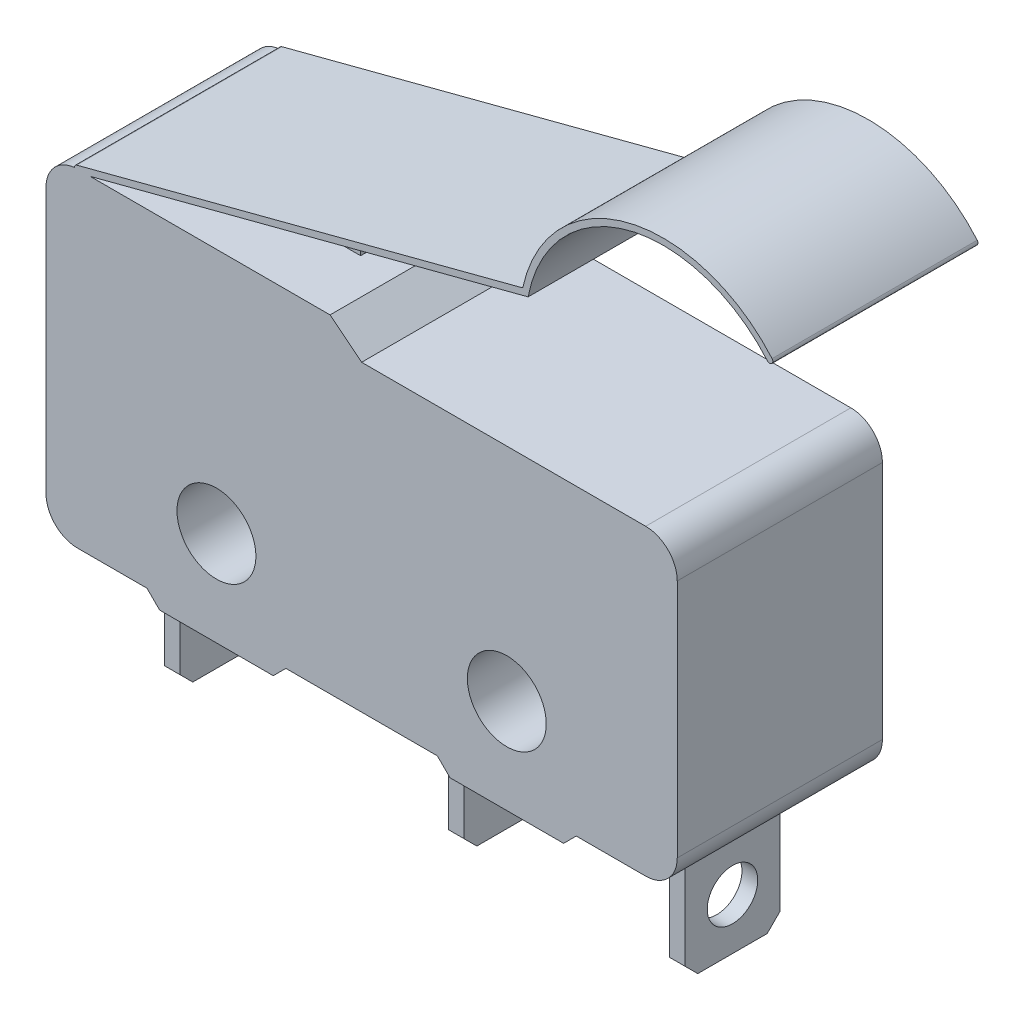
from build123d import *

# Parameters (mm, degrees)
SKETCH2_R                = 1.25
BOSS_EXTRUDE1_DEPTH      = 6.5
CHAMFER1_SIZE            = 0.4
SKETCH3_W                = 2
SKETCH3_H                = 2
BOSS_EXTRUDE2_DEPTH      = 1.5
FILLET1_R                = 1
BOSS_EXTRUDE3_DEPTH      = 4
CHAMFER2_SIZE            = 0.4
SKETCH5_R                = 0.8
CUT_EXTRUDE2_DEPTH       = 18
BOSS_EXTRUDE4_DEPTH      = 0.1
RESSALTO_EXTRUS_O1_REACH = 26.39


with BuildPart() as part:
    # Sketch2 → Boss-Extrude1 (new body)
    with BuildSketch(Plane.XY):
        with BuildLine():
            ThreePointArc((0, 9.8), (0.292893219, 10.507106781), (1, 10.8))
            Line((1, 10.8), (9, 10.8))
            Line((9, 10.8), (10, 10))
            Line((10, 10), (19, 10))
            ThreePointArc((19, 10), (19.707106781, 9.707106781), (20, 9))
            Line((20, 9), (20, 1.4))
            ThreePointArc((20, 1.4), (19.707106781, 0.692893219), (19, 0.4))
            Line((19, 0.4), (16.4, 0.4))
            Line((16.4, 0.4), (16.4, 0))
            Line((16.4, 0), (12.8, 0))
            Line((12.8, 0), (12.8, 0.4))
            Line((12.8, 0.4), (7.2, 0.4))
            Line((7.2, 0.4), (7.2, 0))
            Line((7.2, 0), (3.6, 0))
            Line((3.6, 0), (3.6, 0.4))
            Line((3.6, 0.4), (1, 0.4))
            ThreePointArc((1, 0.4), (0.292893219, 0.692893219), (0, 1.4))
            Line((0, 1.4), (0, 9.8))
        make_face()
        with Locations(Location((14.6, 3, 0), (0, 0, 180))):
            Circle(SKETCH2_R, mode=Mode.SUBTRACT)
        with Locations(Location((5.4, 3, 0), (0, 0, 180))):
            Circle(SKETCH2_R, mode=Mode.SUBTRACT)
    extrude(amount=BOSS_EXTRUDE1_DEPTH)

    # Chamfer1
    chamfer1_edges = [part.edges().sort_by_distance(p)[0] for p in [
        (3.6, 0.4, 3.25),
        (7.2, 0.4, 3.25),
        (12.8, 0.4, 3.25),
        (16.4, 0.4, 3.25),
    ]]
    chamfer(chamfer1_edges, length=CHAMFER1_SIZE - 0.0001)  # a hair under: the kernel refuses the full size

    # Sketch3 → Boss-Extrude2 (add)
    with BuildSketch(Plane(origin=(0, 10.8, 0), x_dir=(1, 0, 0), z_dir=(0, 1, 0))):
        with Locations((6.861600277, -3.393126413)):
            Rectangle(SKETCH3_W, SKETCH3_H)
    extrude(amount=BOSS_EXTRUDE2_DEPTH)

    # Fillet1
    fillet1_edges = [part.edges().sort_by_distance(p)[0] for p in [
        (5.861600277, 12.3, 3.393126413),
        (7.861600277, 12.3, 3.393126413),
    ]]
    fillet(fillet1_edges, radius=FILLET1_R - 0.0001)  # a hair under: the kernel refuses the full size

    # Sketch4 → Boss-Extrude3 (add)
    with BuildSketch(Plane.XZ.offset(-0.4)):
        Polygon((2, 3.25), (2, 4.75), (2.5, 4.75), (2.5, 1.75), (2.037861295, 1.75), align=None)
        Polygon((11, 3.25), (11, 4.75), (11.5, 4.75), (11.5, 1.75), (11, 1.75), align=None)
        Polygon((18, 3.25), (18, 4.75), (18.5, 4.75), (18.5, 1.75), (18, 1.75), align=None)
    extrude(amount=BOSS_EXTRUDE3_DEPTH)

    # Chamfer2
    chamfer2_edges = [part.edges().sort_by_distance(p)[0] for p in [
        (2.268930648, -3.6, 1.75),
        (2.25, -3.6, 4.75),
        (11.25, -3.6, 1.75),
        (11.25, -3.6, 4.75),
        (18.25, -3.6, 1.75),
        (18.25, -3.6, 4.75),
    ]]
    chamfer(chamfer2_edges, length=CHAMFER2_SIZE)

    # Sketch5 → Cut-Extrude2 (cut)
    with BuildSketch(Plane(origin=(18.5, 0, 0), x_dir=(0, 0, -1), z_dir=(1, 0, 0))):
        with Locations(Location((-3.25, -1.983091363, 0), (0, 0, 90))):
            Circle(SKETCH5_R)
    extrude(amount=-CUT_EXTRUDE2_DEPTH, mode=Mode.SUBTRACT)

    # Sketch6 → Boss-Extrude4 (add)
    # profile 1 of 8: a face of its own
    with BuildSketch(Plane(origin=(0, 0, 0), x_dir=(-1, 0, 0), z_dir=(0, 0, -1))):
        with BuildLine():
            Line((-15.857970631, 8.152098297), (-15.857970631, 7.93500428))
            Line((-15.857970631, 7.93500428), (-16.577942586, 7.93500428))
            Line((-16.577942586, 7.93500428), (-16.692001747, 7.37827685))
            add(Edge.make_bspline(
                [(-16.692001747, 7.37827685), (-16.669591766, 7.384463728), (-16.626175972, 7.396449827), (-16.562095485, 7.409758079), (-16.501261152, 7.417780514), (-16.461785095, 7.418875926), (-16.442682837, 7.41940599)],
                knots=[0, 0, 0, 0, 1.100273476, 2.13160584, 3.095893838, 4, 4, 4, 4], degree=3))
            add(Edge.make_bspline(
                [(-16.442682837, 7.41940599), (-16.41904648, 7.4188944), (-16.372571497, 7.417888487), (-16.304572705, 7.408229321), (-16.23966186, 7.393025658), (-16.177974713, 7.371786105), (-16.119397141, 7.344626409), (-16.064468092, 7.310699302), (-16.012363069, 7.27106724), (-15.964016833, 7.225501447), (-15.920156895, 7.175353612), (-15.881593653, 7.121434328), (-15.848838182, 7.064267599), (-15.822494297, 7.003307231), (-15.801458057, 6.939227171), (-15.787456612, 6.871353181), (-15.778133174, 6.800325032), (-15.77709154, 6.751759888), (-15.776560374, 6.726994799)],
                knots=[0, 0, 0, 0, 1.052922333, 2.070308379, 3.05430497, 4.020497103, 4.973039431, 5.925935799, 6.892292201, 7.88610001, 8.88166317, 9.857072816, 10.836096531, 11.812156883, 12.81219415, 13.836441305, 14.89672472, 16, 16, 16, 16], degree=3))
            add(Edge.make_bspline(
                [(-15.776560374, 6.726994799), (-15.776962587, 6.709745646), (-15.777761575, 6.675480449), (-15.781824721, 6.624593242), (-15.78964775, 6.574783338), (-15.800151087, 6.52604413), (-15.813783883, 6.47846789), (-15.830287263, 6.431918442), (-15.850483908, 6.386685514), (-15.872637169, 6.342341108), (-15.897581467, 6.299887725), (-15.925266565, 6.260185719), (-15.954516171, 6.222639511), (-15.985988819, 6.187651777), (-16.01997704, 6.155452428), (-16.05606921, 6.125850372), (-16.093977331, 6.098344996), (-16.134287882, 6.074052802), (-16.176102622, 6.051699014), (-16.2200254, 6.033360494), (-16.265056396, 6.016965079), (-16.311843725, 6.00389646), (-16.360281412, 5.993656296), (-16.4104493, 5.986701171), (-16.462084276, 5.981635421), (-16.497084879, 5.98131831), (-16.514764835, 5.981158127)],
                knots=[0, 0, 0, 0, 1.056347294, 2.098418968, 3.122841568, 4.141288669, 5.149314143, 6.15115421, 7.162517403, 8.180376062, 9.185164535, 10.17417709, 11.141909838, 12.097768115, 13.052685741, 14.0056014, 14.954263652, 15.917497458, 16.885230207, 17.854509472, 18.828990115, 19.81800267, 20.826176721, 21.857883937, 22.917946725, 24, 24, 24, 24], degree=3))
            add(Edge.make_bspline(
                [(-16.514764835, 5.981158127), (-16.535855411, 5.981575919), (-16.577348627, 5.982397876), (-16.638139637, 5.990996675), (-16.696628946, 6.003311995), (-16.752345722, 6.021839644), (-16.805789295, 6.045054818), (-16.856240177, 6.07439555), (-16.90498748, 6.107644818), (-16.950049521, 6.146881983), (-16.991872504, 6.189769086), (-17.029311202, 6.236310136), (-17.062653889, 6.285736989), (-17.091366622, 6.338289682), (-17.115858282, 6.393830127), (-17.135098775, 6.452566418), (-17.150628066, 6.514191659), (-17.157197849, 6.556617829), (-17.160534733, 6.578166674)],
                knots=[0, 0, 0, 0, 1.0467383, 2.05933395, 3.04377827, 4.011590433, 4.970194871, 5.932262533, 6.905835911, 7.896367577, 8.894135286, 9.877477877, 10.858688626, 11.851381753, 12.8477658, 13.868841284, 14.917554742, 16, 16, 16, 16], degree=3))
            Line((-17.160534733, 6.578166674), (-16.970577468, 6.578166674))
            add(Edge.make_bspline(
                [(-16.970577468, 6.578166674), (-16.965903531, 6.557981867), (-16.956919965, 6.519185547), (-16.93720125, 6.464677545), (-16.913091887, 6.416103538), (-16.884423543, 6.372820981), (-16.850224239, 6.335078397), (-16.811199299, 6.301443317), (-16.767446152, 6.27109931), (-16.718827389, 6.245806493), (-16.66753567, 6.22423539), (-16.613852643, 6.20987127), (-16.559240014, 6.199771206), (-16.522302143, 6.198760189), (-16.503740529, 6.198252144)],
                knots=[0, 0, 0, 0, 1.136247022, 2.183929868, 3.172523383, 4.106158343, 5.02341133, 5.958108904, 6.928429099, 7.938127109, 8.96079061, 9.975095812, 10.982467395, 12, 12, 12, 12], degree=3))
            add(Edge.make_bspline(
                [(-16.503740529, 6.198252144), (-16.485622803, 6.198748519), (-16.449948853, 6.199725886), (-16.397448633, 6.207248526), (-16.3467618, 6.218834296), (-16.298388494, 6.236172732), (-16.251482229, 6.25724549), (-16.20722952, 6.284287464), (-16.164350161, 6.315408523), (-16.124176957, 6.351063247), (-16.087383576, 6.390354443), (-16.054873921, 6.432371724), (-16.02779455, 6.477194769), (-16.004974398, 6.524047581), (-15.987645975, 6.573443661), (-15.975284048, 6.625151514), (-15.968025055, 6.679298859), (-15.967026485, 6.716231252), (-15.966517639, 6.735051022)],
                knots=[0, 0, 0, 0, 1.027316725, 2.022795036, 3.002884548, 3.971462791, 4.93288096, 5.914575861, 6.907176829, 7.935150275, 8.956128384, 9.956726525, 10.942570165, 11.921478529, 12.907843606, 13.90538589, 14.932640048, 16, 16, 16, 16], degree=3))
            add(Edge.make_bspline(
                [(-15.966517639, 6.735051022), (-15.966915863, 6.752030167), (-15.967695328, 6.785264427), (-15.974063816, 6.833886805), (-15.985141223, 6.879892883), (-16.000516617, 6.923504824), (-16.020038034, 6.964763763), (-16.043893661, 7.00371228), (-16.072531192, 7.039837027), (-16.105243905, 7.073154905), (-16.141080911, 7.103903948), (-16.180658793, 7.1301168), (-16.223149321, 7.152168789), (-16.268040554, 7.171199435), (-16.316400279, 7.184867505), (-16.367270814, 7.195129036), (-16.421201489, 7.201064993), (-16.458074239, 7.201888612), (-16.477027789, 7.202311973)],
                knots=[0, 0, 0, 0, 1.045622112, 2.046656509, 3.013763289, 3.955457236, 4.890082067, 5.820317437, 6.762574623, 7.722996705, 8.69280354, 9.665887285, 10.63943826, 11.638615906, 12.663482002, 13.728887084, 14.832589034, 16, 16, 16, 16], degree=3))
            add(Edge.make_bspline(
                [(-16.477027789, 7.202311973), (-16.493434332, 7.201960853), (-16.52730968, 7.201235881), (-16.579272532, 7.195897952), (-16.633877527, 7.187286569), (-16.69091534, 7.175441553), (-16.750557267, 7.159940854), (-16.812677442, 7.141365894), (-16.87740648, 7.119157828), (-16.921020532, 7.102386442), (-16.943440716, 7.093764964)],
                knots=[0, 0, 0, 0, 0.817624296, 1.688186739, 2.600797293, 3.572016777, 4.590301741, 5.671205678, 6.80286297, 8, 8, 8, 8], degree=3))
            Line((-16.943440716, 7.093764964), (-16.726346699, 8.152098297))
            Line((-16.726346699, 8.152098297), (-15.857970631, 8.152098297))
        make_face()
    # profile 2 of 8: a face of its own
    with BuildSketch(Plane(origin=(0, 0, 0), x_dir=(-1, 0, 0), z_dir=(0, 0, -1))):
        Polygon((-14.501133024, 8.152098297), (-13.524209947, 6.035431631), (-13.73070367, 6.035431631), (-14.043624343, 6.713850434), (-15.003162938, 6.713850434), (-15.324987858, 6.035431631), (-15.532329605, 6.035431631), (-14.528269776, 8.152098297), align=None)
        Polygon((-14.516821459, 7.739534863), (-14.900128083, 6.930944451), (-14.143691117, 6.930944451), align=None, mode=Mode.SUBTRACT)
    # profile 3 of 8: a face of its own
    with BuildSketch(Plane(origin=(0, 0, 0), x_dir=(-1, 0, 0), z_dir=(0, 0, -1))):
        with BuildLine():
            Line((-13.062885161, 7.500816246), (-13.252842426, 7.500816246))
            add(Edge.make_bspline(
                [(-13.252842426, 7.500816246), (-13.251604385, 7.526017212), (-13.249172908, 7.575511237), (-13.237786276, 7.64767379), (-13.221493459, 7.716649787), (-13.198457199, 7.781885402), (-13.169848164, 7.843957443), (-13.135540005, 7.902619357), (-13.094903724, 7.957647361), (-13.048816794, 8.008531329), (-12.998761474, 8.055211431), (-12.944752644, 8.095521982), (-12.887998747, 8.129580765), (-12.828671968, 8.158053706), (-12.76610296, 8.179425899), (-12.700859517, 8.195283747), (-12.632654992, 8.20482468), (-12.586185074, 8.205850227), (-12.562551293, 8.206371802)],
                knots=[0, 0, 0, 0, 1.10065271, 2.161652631, 3.183658789, 4.190468796, 5.17591951, 6.163126047, 7.15150782, 8.156236427, 9.156009102, 10.134482811, 11.092018607, 12.041330605, 13.001268258, 13.972401359, 14.968799086, 16, 16, 16, 16], degree=3))
            add(Edge.make_bspline(
                [(-12.562551293, 8.206371802), (-12.539341696, 8.205828449), (-12.493735667, 8.204760782), (-12.427174353, 8.195591969), (-12.363809037, 8.18123154), (-12.303763578, 8.161083645), (-12.247517053, 8.133999729), (-12.194646926, 8.101465027), (-12.144523769, 8.063836844), (-12.099404429, 8.019535728), (-12.057973352, 7.972241905), (-12.02223056, 7.921751601), (-11.991621647, 7.869603414), (-11.966108145, 7.815399692), (-11.947326575, 7.75863007), (-11.933067373, 7.700121048), (-11.925007461, 7.639266995), (-11.923770467, 7.598078745), (-11.923141571, 7.577138362)],
                knots=[0, 0, 0, 0, 1.111607364, 2.184268762, 3.212621178, 4.221274766, 5.211760367, 6.196651075, 7.1921475, 8.207485113, 9.220403448, 10.201281604, 11.166441695, 12.114753415, 13.065576456, 14.026450734, 14.996634279, 16, 16, 16, 16], degree=3))
            add(Edge.make_bspline(
                [(-11.923141571, 7.577138362), (-11.924165592, 7.547657528), (-11.926195663, 7.489213209), (-11.943561025, 7.40332803), (-11.970682486, 7.320116771), (-12.00333803, 7.25314707), (-12.036280889, 7.199182052), (-12.065967144, 7.154750978), (-12.100719673, 7.106911004), (-12.141044288, 7.055822329), (-12.186106834, 7.001084782), (-12.236315476, 6.942731429), (-12.292028249, 6.881365168), (-12.331131247, 6.839451781), (-12.351393441, 6.817733313)],
                knots=[0, 0, 0, 0, 1.184426356, 2.348067706, 3.509069118, 4.696110526, 5.333549288, 6.050745305, 6.844228056, 7.710549037, 8.667450064, 9.695053472, 10.805634456, 12, 12, 12, 12], degree=3))
            Line((-12.351393441, 6.817733313), (-12.880984119, 6.252525648))
            Line((-12.880984119, 6.252525648), (-11.896004819, 6.252525648))
            Line((-11.896004819, 6.252525648), (-11.896004819, 6.035431631))
            Line((-11.896004819, 6.035431631), (-13.334252682, 6.035431631))
            Line((-13.334252682, 6.035431631), (-12.51336593, 6.911439911))
            add(Edge.make_bspline(
                [(-12.51336593, 6.911439911), (-12.493379827, 6.932303172), (-12.454990613, 6.972377228), (-12.400693531, 7.030883685), (-12.351926143, 7.085160788), (-12.308372767, 7.135105986), (-12.270978219, 7.181449839), (-12.237793583, 7.222691398), (-12.211204869, 7.260642899), (-12.182348415, 7.304633651), (-12.15439996, 7.358343957), (-12.13038344, 7.423980998), (-12.115739222, 7.491549384), (-12.113982488, 7.53721014), (-12.113098836, 7.560177891)],
                knots=[0, 0, 0, 0, 1.329631726, 2.553950428, 3.673215718, 4.687767853, 5.603093632, 6.413772471, 7.123043292, 7.734684054, 8.834405432, 9.900288307, 10.943827018, 12, 12, 12, 12], degree=3))
            add(Edge.make_bspline(
                [(-12.113098836, 7.560177891), (-12.113483309, 7.574620451), (-12.114241031, 7.603083964), (-12.120928305, 7.644816018), (-12.131034182, 7.685071882), (-12.145515362, 7.72397538), (-12.164629914, 7.761135369), (-12.187897149, 7.796597084), (-12.214742568, 7.83088041), (-12.24579786, 7.8630255), (-12.279913398, 7.892466039), (-12.31595373, 7.918545843), (-12.354084031, 7.940340924), (-12.394143533, 7.958207706), (-12.436020555, 7.972223293), (-12.479796092, 7.98193491), (-12.525349187, 7.988032413), (-12.556454206, 7.988857412), (-12.572303563, 7.989277785)],
                knots=[0, 0, 0, 0, 0.991446411, 1.95395049, 2.89581595, 3.838931463, 4.798493298, 5.75982156, 6.748411868, 7.785213223, 8.824556874, 9.840280684, 10.836137867, 11.835679398, 12.848801643, 13.863922112, 14.911575587, 16, 16, 16, 16], degree=3))
            add(Edge.make_bspline(
                [(-12.572303563, 7.989277785), (-12.5888564, 7.98884536), (-12.621363439, 7.98799615), (-12.669090664, 7.982055777), (-12.714620634, 7.971807579), (-12.75806788, 7.957791209), (-12.799505915, 7.939975801), (-12.838733218, 7.917786032), (-12.875661727, 7.891307443), (-12.910360863, 7.861286725), (-12.942330984, 7.827862986), (-12.970420285, 7.790603627), (-12.99496395, 7.750188952), (-13.016378106, 7.70672801), (-13.033768452, 7.659826438), (-13.047056976, 7.609650731), (-13.057571879, 7.556418752), (-13.061084651, 7.519658249), (-13.062885161, 7.500816246)],
                knots=[0, 0, 0, 0, 1.031018746, 2.02475058, 2.990194455, 3.934040569, 4.864654155, 5.795059489, 6.735614925, 7.690564532, 8.649604399, 9.611025574, 10.590972636, 11.591080095, 12.624614302, 13.701020113, 14.821632451, 16, 16, 16, 16], degree=3))
        make_face()
    # profile 4 of 8: a face of its own
    with BuildSketch(Plane(origin=(0, 0, 0), x_dir=(-1, 0, 0), z_dir=(0, 0, -1))):
        with BuildLine():
            Line((-10.376346699, 8.152098297), (-10.376346699, 7.93500428))
            Line((-10.376346699, 7.93500428), (-11.096318654, 7.93500428))
            Line((-11.096318654, 7.93500428), (-11.210377816, 7.37827685))
            add(Edge.make_bspline(
                [(-11.210377816, 7.37827685), (-11.187967834, 7.384463728), (-11.14455204, 7.396449827), (-11.080471553, 7.409758079), (-11.01963722, 7.417780514), (-10.980161163, 7.418875926), (-10.961058905, 7.41940599)],
                knots=[0, 0, 0, 0, 1.100273476, 2.13160584, 3.095893838, 4, 4, 4, 4], degree=3))
            add(Edge.make_bspline(
                [(-10.961058905, 7.41940599), (-10.937422548, 7.4188944), (-10.890947565, 7.417888487), (-10.822948774, 7.408229321), (-10.758037929, 7.393025658), (-10.696350781, 7.371786105), (-10.63777321, 7.344626409), (-10.582844161, 7.310699302), (-10.530739137, 7.27106724), (-10.482392902, 7.225501447), (-10.438532963, 7.175353612), (-10.399969722, 7.121434328), (-10.36721425, 7.064267599), (-10.340870365, 7.003307231), (-10.319834125, 6.939227171), (-10.305832681, 6.871353181), (-10.296509242, 6.800325032), (-10.295467609, 6.751759888), (-10.294936443, 6.726994799)],
                knots=[0, 0, 0, 0, 1.052922333, 2.070308379, 3.05430497, 4.020497103, 4.973039431, 5.925935799, 6.892292201, 7.88610001, 8.88166317, 9.857072816, 10.836096531, 11.812156883, 12.81219415, 13.836441305, 14.89672472, 16, 16, 16, 16], degree=3))
            add(Edge.make_bspline(
                [(-10.294936443, 6.726994799), (-10.295338655, 6.709745646), (-10.296137644, 6.675480449), (-10.30020079, 6.624593242), (-10.308023818, 6.574783338), (-10.318527156, 6.52604413), (-10.332159951, 6.47846789), (-10.348663332, 6.431918442), (-10.368859977, 6.386685514), (-10.391013237, 6.342341108), (-10.415957536, 6.299887725), (-10.443642633, 6.260185719), (-10.47289224, 6.222639511), (-10.504364887, 6.187651777), (-10.538353108, 6.155452428), (-10.574445278, 6.125850372), (-10.612353399, 6.098344996), (-10.65266395, 6.074052802), (-10.69447869, 6.051699014), (-10.738401469, 6.033360494), (-10.783432464, 6.016965079), (-10.830219793, 6.00389646), (-10.87865748, 5.993656296), (-10.928825368, 5.986701171), (-10.980460345, 5.981635421), (-11.015460948, 5.98131831), (-11.033140903, 5.981158127)],
                knots=[0, 0, 0, 0, 1.056347294, 2.098418968, 3.122841568, 4.141288669, 5.149314143, 6.15115421, 7.162517403, 8.180376062, 9.185164535, 10.17417709, 11.141909838, 12.097768115, 13.052685741, 14.0056014, 14.954263652, 15.917497458, 16.885230207, 17.854509472, 18.828990115, 19.81800267, 20.826176721, 21.857883937, 22.917946725, 24, 24, 24, 24], degree=3))
            add(Edge.make_bspline(
                [(-11.033140903, 5.981158127), (-11.054231479, 5.981575919), (-11.095724696, 5.982397876), (-11.156515705, 5.990996675), (-11.215005015, 6.003311995), (-11.27072179, 6.021839644), (-11.324165364, 6.045054818), (-11.374616246, 6.07439555), (-11.423363548, 6.107644818), (-11.468425589, 6.146881983), (-11.510248572, 6.189769086), (-11.547687271, 6.236310136), (-11.581029957, 6.285736989), (-11.60974269, 6.338289682), (-11.634234351, 6.393830127), (-11.653474844, 6.452566418), (-11.669004134, 6.514191659), (-11.675573917, 6.556617829), (-11.678910802, 6.578166674)],
                knots=[0, 0, 0, 0, 1.0467383, 2.05933395, 3.04377827, 4.011590433, 4.970194871, 5.932262533, 6.905835911, 7.896367577, 8.894135286, 9.877477877, 10.858688626, 11.851381753, 12.8477658, 13.868841284, 14.917554742, 16, 16, 16, 16], degree=3))
            Line((-11.678910802, 6.578166674), (-11.488953537, 6.578166674))
            add(Edge.make_bspline(
                [(-11.488953537, 6.578166674), (-11.4842796, 6.557981867), (-11.475296033, 6.519185547), (-11.455577318, 6.464677545), (-11.431467956, 6.416103538), (-11.402799612, 6.372820981), (-11.368600307, 6.335078397), (-11.329575367, 6.301443317), (-11.28582222, 6.27109931), (-11.237203458, 6.245806493), (-11.185911738, 6.22423539), (-11.132228711, 6.20987127), (-11.077616083, 6.199771206), (-11.040678211, 6.198760189), (-11.022116598, 6.198252144)],
                knots=[0, 0, 0, 0, 1.136247022, 2.183929868, 3.172523383, 4.106158343, 5.02341133, 5.958108904, 6.928429099, 7.938127109, 8.96079061, 9.975095812, 10.982467395, 12, 12, 12, 12], degree=3))
            add(Edge.make_bspline(
                [(-11.022116598, 6.198252144), (-11.003998872, 6.198748519), (-10.968324921, 6.199725886), (-10.915824702, 6.207248526), (-10.865137868, 6.218834296), (-10.816764562, 6.236172732), (-10.769858298, 6.25724549), (-10.725605589, 6.284287464), (-10.68272623, 6.315408523), (-10.642553025, 6.351063247), (-10.605759644, 6.390354443), (-10.57324999, 6.432371724), (-10.546170618, 6.477194769), (-10.523350467, 6.524047581), (-10.506022043, 6.573443661), (-10.493660116, 6.625151514), (-10.486401124, 6.679298859), (-10.485402553, 6.716231252), (-10.484893708, 6.735051022)],
                knots=[0, 0, 0, 0, 1.027316725, 2.022795036, 3.002884548, 3.971462791, 4.93288096, 5.914575861, 6.907176829, 7.935150275, 8.956128384, 9.956726525, 10.942570165, 11.921478529, 12.907843606, 13.90538589, 14.932640048, 16, 16, 16, 16], degree=3))
            add(Edge.make_bspline(
                [(-10.484893708, 6.735051022), (-10.485291931, 6.752030167), (-10.486071396, 6.785264427), (-10.492439884, 6.833886805), (-10.503517291, 6.879892883), (-10.518892685, 6.923504824), (-10.538414102, 6.964763763), (-10.562269729, 7.00371228), (-10.59090726, 7.039837027), (-10.623619974, 7.073154905), (-10.659456979, 7.103903948), (-10.699034862, 7.1301168), (-10.741525389, 7.152168789), (-10.786416623, 7.171199435), (-10.834776347, 7.184867505), (-10.885646882, 7.195129036), (-10.939577558, 7.201064993), (-10.976450307, 7.201888612), (-10.995403857, 7.202311973)],
                knots=[0, 0, 0, 0, 1.045622112, 2.046656509, 3.013763289, 3.955457236, 4.890082067, 5.820317437, 6.762574623, 7.722996705, 8.69280354, 9.665887285, 10.63943826, 11.638615906, 12.663482002, 13.728887084, 14.832589034, 16, 16, 16, 16], degree=3))
            add(Edge.make_bspline(
                [(-10.995403857, 7.202311973), (-11.0118104, 7.201960853), (-11.045685748, 7.201235881), (-11.097648601, 7.195897952), (-11.152253595, 7.187286569), (-11.209291409, 7.175441553), (-11.268933335, 7.159940854), (-11.331053511, 7.141365894), (-11.395782548, 7.119157828), (-11.439396601, 7.102386442), (-11.461816785, 7.093764964)],
                knots=[0, 0, 0, 0, 0.817624296, 1.688186739, 2.600797293, 3.572016777, 4.590301741, 5.671205678, 6.80286297, 8, 8, 8, 8], degree=3))
            Line((-11.461816785, 7.093764964), (-11.244722768, 8.152098297))
            Line((-11.244722768, 8.152098297), (-10.376346699, 8.152098297))
        make_face()
    # profile 5 of 8: a face of its own
    with BuildSketch(Plane(origin=(0, 0, 0), x_dir=(-1, 0, 0), z_dir=(0, 0, -1))):
        with BuildLine():
            add(Edge.make_bspline(
                [(-10.077842426, 7.092916941), (-10.077644053, 7.126842504), (-10.077258711, 7.192743399), (-10.072971904, 7.288770301), (-10.065850625, 7.37885581), (-10.056091357, 7.463004235), (-10.044215055, 7.541237302), (-10.028360927, 7.613345941), (-10.01033128, 7.679663894), (-9.989435277, 7.740407418), (-9.965856947, 7.796394886), (-9.940194323, 7.848661556), (-9.911428947, 7.897128343), (-9.881204814, 7.942568817), (-9.848298466, 7.984239146), (-9.81364634, 8.022727804), (-9.775895968, 8.057145258), (-9.736330624, 8.088499927), (-9.694592096, 8.115986036), (-9.651870103, 8.140196311), (-9.607870586, 8.160879088), (-9.562473418, 8.177141399), (-9.516086633, 8.190573673), (-9.468548074, 8.19975937), (-9.419779249, 8.205539024), (-9.386861191, 8.206091575), (-9.370166811, 8.206371802)],
                knots=[0, 0, 0, 0, 1.646270934, 3.197905019, 4.663502075, 6.030701355, 7.308322542, 8.50163776, 9.611534131, 10.641858119, 11.616356847, 12.558055219, 13.465016945, 14.349605745, 15.204443733, 16.039544428, 16.859896111, 17.680448484, 18.487036065, 19.28249412, 20.06191084, 20.843045899, 21.620316918, 22.403196591, 23.190181807, 24, 24, 24, 24], degree=3))
            add(Edge.make_bspline(
                [(-9.370166811, 8.206371802), (-9.353332974, 8.20607679), (-9.319855769, 8.205490104), (-9.270361828, 8.199851338), (-9.222011306, 8.190494992), (-9.175010336, 8.177238022), (-9.128972845, 8.160791113), (-9.084258922, 8.140176523), (-9.04059083, 8.116180256), (-8.998662513, 8.087983911), (-8.958013674, 8.05654701), (-8.919642763, 8.021009587), (-8.883546287, 7.981730471), (-8.849271222, 7.939129915), (-8.81778998, 7.89239084), (-8.787809856, 7.842326164), (-8.760975339, 7.788060355), (-8.735131036, 7.730498834), (-8.712823191, 7.668048907), (-8.692705034, 7.6010626), (-8.676449657, 7.528748687), (-8.662909478, 7.451486577), (-8.652419946, 7.368992527), (-8.644780205, 7.281443374), (-8.640744578, 7.188781519), (-8.639984573, 7.125427963), (-8.639594562, 7.092916941)],
                knots=[0, 0, 0, 0, 0.810914788, 1.612654377, 2.396697861, 3.181598691, 3.963628158, 4.749916497, 5.551656086, 6.361998678, 7.18212741, 8.025565596, 8.878627764, 9.750805457, 10.657531673, 11.591944965, 12.560506719, 13.57287815, 14.630710178, 15.753379473, 16.941251878, 18.199788006, 19.531962791, 20.947069417, 22.433333509, 24, 24, 24, 24], degree=3))
            add(Edge.make_bspline(
                [(-8.639594562, 7.092916941), (-8.639988616, 7.06054772), (-8.640756413, 6.997477614), (-8.644734964, 6.905232691), (-8.652571851, 6.81814816), (-8.662375034, 6.736015166), (-8.675952521, 6.659175558), (-8.692647074, 6.587363439), (-8.711183222, 6.520268691), (-8.734064264, 6.458440972), (-8.759107884, 6.401017787), (-8.78635555, 6.347395274), (-8.815547302, 6.297099468), (-8.847350972, 6.250532954), (-8.881249941, 6.207365862), (-8.917969746, 6.168360157), (-8.956475291, 6.132575988), (-8.997243752, 6.10073429), (-9.039825976, 6.072863956), (-9.083344084, 6.047939389), (-9.128570225, 6.027841521), (-9.174479487, 6.010584615), (-9.221728547, 5.997400533), (-9.270258507, 5.988284439), (-9.319822516, 5.981890988), (-9.353327272, 5.981403259), (-9.370166811, 5.981158127)],
                knots=[0, 0, 0, 0, 1.561518951, 3.042555995, 4.452378317, 5.7783523, 7.031515105, 8.214008947, 9.334062868, 10.386615937, 11.391082383, 12.354592575, 13.286541444, 14.194233754, 15.072674879, 15.931287219, 16.775624067, 17.606195743, 18.42308326, 19.229000347, 20.022332153, 20.807536673, 21.593273796, 22.3848459, 23.188221202, 24, 24, 24, 24], degree=3))
            add(Edge.make_bspline(
                [(-9.370166811, 5.981158127), (-9.386860728, 5.981440161), (-9.419777873, 5.981996277), (-9.468553387, 5.987749819), (-9.515895627, 5.996999957), (-9.562038207, 6.009951903), (-9.607217861, 6.025805637), (-9.650818949, 6.046460484), (-9.693326262, 6.07024823), (-9.734626394, 6.097338795), (-9.773943272, 6.128376194), (-9.811498143, 6.162705073), (-9.846347559, 6.201182088), (-9.878783417, 6.24319969), (-9.909610604, 6.288371317), (-9.93796751, 6.337313714), (-9.964196551, 6.389832817), (-9.988171424, 6.446267934), (-10.009427996, 6.507442581), (-10.028204467, 6.574056608), (-10.043029696, 6.646697969), (-10.055719388, 6.724783234), (-10.06595461, 6.808647944), (-10.072942226, 6.898337629), (-10.077261021, 6.993796398), (-10.077645088, 7.059273833), (-10.077842426, 7.092916941)],
                knots=[0, 0, 0, 0, 0.810891512, 1.598919785, 2.382837074, 3.152667961, 3.926044502, 4.706494248, 5.493654104, 6.291793342, 7.103789334, 7.925228297, 8.761435821, 9.622817696, 10.50288917, 11.416980706, 12.369136599, 13.353924996, 14.394355917, 15.514179734, 16.714354668, 17.994756427, 19.357759367, 20.818452758, 22.365282078, 24, 24, 24, 24], degree=3))
        make_face()
        with BuildLine():
            add(Edge.make_bspline(
                [(-9.887885161, 7.093764964), (-9.887812924, 7.065493132), (-9.887672726, 7.010623057), (-9.884010166, 6.930889276), (-9.87902074, 6.856521505), (-9.872585289, 6.787425319), (-9.863028268, 6.723834597), (-9.852319877, 6.665311979), (-9.839288413, 6.612167174), (-9.823869998, 6.564035498), (-9.806308258, 6.520100109), (-9.78713376, 6.479217469), (-9.766535132, 6.440904632), (-9.743482122, 6.405505735), (-9.718375393, 6.372905341), (-9.691782041, 6.342526437), (-9.662709574, 6.31543493), (-9.622490644, 6.282942974), (-9.569394681, 6.249367117), (-9.502495643, 6.220129244), (-9.433753295, 6.201755092), (-9.387095158, 6.199418439), (-9.363806635, 6.198252144)],
                knots=[0, 0, 0, 0, 1.459021318, 2.831673884, 4.118529203, 5.306027144, 6.411944654, 7.436330062, 8.375795394, 9.233974572, 10.042671642, 10.816086306, 11.563610507, 12.285937304, 12.993564865, 13.685989202, 14.367179055, 15.041617293, 16.353048772, 17.594441528, 18.799311195, 20, 20, 20, 20], degree=3))
            add(Edge.make_bspline(
                [(-9.363806635, 6.198252144), (-9.340367472, 6.199218421), (-9.293537538, 6.20114898), (-9.225118529, 6.219774883), (-9.158697365, 6.24787789), (-9.106644335, 6.281108048), (-9.067042987, 6.312754228), (-9.038669379, 6.339735468), (-9.012627092, 6.369946873), (-8.987927361, 6.402543114), (-8.965273539, 6.43814695), (-8.944673451, 6.476587174), (-8.925875427, 6.517970534), (-8.915165671, 6.546859852), (-8.909690049, 6.561630215)],
                knots=[0, 0, 0, 0, 1.353760809, 2.704726607, 4.075137775, 5.516104923, 6.260822281, 7.007110065, 7.778089737, 8.566572457, 9.372053459, 10.217411131, 11.088608312, 12, 12, 12, 12], degree=3))
            add(Edge.make_bspline(
                [(-8.909690049, 6.561630215), (-8.903308741, 6.580516772), (-8.890351951, 6.618864582), (-8.873653402, 6.678351171), (-8.860502613, 6.740764271), (-8.848671434, 6.80573089), (-8.840596015, 6.873730137), (-8.834096147, 6.944551617), (-8.830267589, 7.018248727), (-8.829793001, 7.068319983), (-8.829551827, 7.093764964)],
                knots=[0, 0, 0, 0, 0.884706709, 1.796334032, 2.740027952, 3.714592787, 4.726048262, 5.777819803, 6.87074269, 8, 8, 8, 8], degree=3))
            add(Edge.make_bspline(
                [(-8.829551827, 7.093764964), (-8.829884561, 7.119205829), (-8.830535459, 7.1689736), (-8.833023442, 7.241858405), (-8.839448175, 7.311084146), (-8.846583832, 7.376949051), (-8.857105009, 7.43908852), (-8.868449016, 7.498022752), (-8.883689749, 7.553021629), (-8.899969804, 7.604946233), (-8.918602757, 7.653206629), (-8.939113701, 7.698027824), (-8.961019241, 7.739626205), (-8.984811929, 7.777887641), (-9.010209319, 7.812983512), (-9.037881741, 7.844210148), (-9.066731528, 7.872535362), (-9.107140017, 7.904867487), (-9.160041135, 7.937834084), (-9.225866836, 7.968172424), (-9.294368607, 7.985594582), (-9.340677315, 7.988050936), (-9.363806635, 7.989277785)],
                knots=[0, 0, 0, 0, 1.31362396, 2.569729283, 3.763502607, 4.902122613, 5.988968491, 7.01645872, 7.998833611, 8.933434873, 9.825090667, 10.667526885, 11.477055099, 12.250526234, 12.991942729, 13.710640831, 14.402115721, 15.076753259, 16.378508321, 17.609869233, 18.806226677, 20, 20, 20, 20], degree=3))
            add(Edge.make_bspline(
                [(-9.363806635, 7.989277785), (-9.387217326, 7.988049243), (-9.434081358, 7.985589922), (-9.503295121, 7.968237335), (-9.569640134, 7.937991399), (-9.622401361, 7.904758297), (-9.662838032, 7.87310608), (-9.691311851, 7.845658082), (-9.718009775, 7.815633919), (-9.74260405, 7.782733713), (-9.765638998, 7.747376086), (-9.786794182, 7.709282881), (-9.805854662, 7.668261056), (-9.823443882, 7.624345402), (-9.83890933, 7.576217878), (-9.851666155, 7.523138535), (-9.863451182, 7.464802057), (-9.871794035, 7.400866926), (-9.879210688, 7.331753433), (-9.883977027, 7.257200008), (-9.887684978, 7.177332501), (-9.887817097, 7.122178725), (-9.887885161, 7.093764964)],
                knots=[0, 0, 0, 0, 1.207732386, 2.417664972, 3.655092373, 4.956220595, 5.625982001, 6.301752483, 6.994047911, 7.697131622, 8.419323945, 9.170223765, 9.943494443, 10.752040957, 11.610060368, 12.549350801, 13.567764191, 14.679664412, 15.874934091, 17.154273443, 18.533957287, 20, 20, 20, 20], degree=3))
        make_face(mode=Mode.SUBTRACT)
    # profile 6 of 8: a face of its own
    with BuildSketch(Plane(origin=(0, 0, 0), x_dir=(-1, 0, 0), z_dir=(0, 0, -1))):
        Polygon((-8.422500545, 8.152098297), (-8.218974904, 8.152098297), (-7.513419349, 6.484036065), (-6.807863793, 8.152098297), (-6.604338152, 8.152098297), (-7.499850973, 6.035431631), (-7.526987725, 6.035431631), align=None)
    # profile 7 of 8: a face of its own
    with BuildSketch(Plane(origin=(0, 0, 0), x_dir=(-1, 0, 0), z_dir=(0, 0, -1))):
        Polygon((-5.356047554, 8.152098297), (-4.379124477, 6.035431631), (-4.5856182, 6.035431631), (-4.898538873, 6.713850434), (-5.858077468, 6.713850434), (-6.179902388, 6.035431631), (-6.387244135, 6.035431631), (-5.383184306, 8.152098297), align=None)
        Polygon((-5.371735989, 7.739534863), (-5.755042613, 6.930944451), (-4.998605647, 6.930944451), align=None, mode=Mode.SUBTRACT)
    # profile 8 of 8: a face of its own
    with BuildSketch(Plane(origin=(0, 0, 0), x_dir=(-1, 0, 0), z_dir=(0, 0, -1))):
        with BuildLine():
            Line((-2.045363793, 7.763703532), (-2.2115764, 7.636500007))
            add(Edge.make_bspline(
                [(-2.2115764, 7.636500007), (-2.223433294, 7.650630855), (-2.246987227, 7.678702038), (-2.284881125, 7.718120143), (-2.324373071, 7.755050087), (-2.365447968, 7.789667795), (-2.40884515, 7.820762696), (-2.453513347, 7.84995522), (-2.500199784, 7.8761219), (-2.564759167, 7.907849515), (-2.649212865, 7.940957904), (-2.755526887, 7.96871843), (-2.866507408, 7.986390284), (-2.942222147, 7.988304259), (-2.980733718, 7.989277785)],
                knots=[0, 0, 0, 0, 0.757959112, 1.505699292, 2.245454638, 2.979532153, 3.711538275, 4.438200793, 5.171680507, 5.909471876, 7.393775596, 8.890124382, 10.418191784, 12, 12, 12, 12], degree=3))
            add(Edge.make_bspline(
                [(-2.980733718, 7.989277785), (-3.001950761, 7.989033483), (-3.044187933, 7.988547149), (-3.106870581, 7.982131154), (-3.16838276, 7.973113422), (-3.228684456, 7.959732869), (-3.287698912, 7.942816095), (-3.345811936, 7.922601678), (-3.402182156, 7.897591846), (-3.457589376, 7.869949232), (-3.510674899, 7.83872692), (-3.560903428, 7.80467075), (-3.60809177, 7.76816182), (-3.652277255, 7.729063294), (-3.693505052, 7.687551251), (-3.731476426, 7.643183292), (-3.766059984, 7.596101264), (-3.797941232, 7.546926012), (-3.826493695, 7.495800777), (-3.85039986, 7.442536329), (-3.871569624, 7.3880448), (-3.888321071, 7.331710527), (-3.901580183, 7.273929902), (-3.910728818, 7.214547854), (-3.917071846, 7.153688438), (-3.917555762, 7.112438044), (-3.917799691, 7.091644905)],
                knots=[0, 0, 0, 0, 1.054917814, 2.100044995, 3.131103042, 4.146048494, 5.169673617, 6.183595914, 7.203665975, 8.234915748, 9.262203917, 10.264457458, 11.251630812, 12.227803204, 13.197192746, 14.159520551, 15.12972552, 16.100847026, 17.073214652, 18.039054194, 19.002613845, 19.979014051, 20.95965708, 21.949030935, 22.966165397, 24, 24, 24, 24], degree=3))
            add(Edge.make_bspline(
                [(-3.917799691, 7.091644905), (-3.917036591, 7.060359774), (-3.915538345, 6.998935568), (-3.902204352, 6.90896477), (-3.881941749, 6.822773696), (-3.851573281, 6.740901124), (-3.814126998, 6.662337498), (-3.766810057, 6.588412097), (-3.712008628, 6.518007793), (-3.648947431, 6.452788487), (-3.579759152, 6.393211139), (-3.505525891, 6.340747692), (-3.426432536, 6.297014406), (-3.343352383, 6.260622286), (-3.255646115, 6.232647979), (-3.163471448, 6.212954438), (-3.067028861, 6.200107976), (-3.001128319, 6.198878079), (-2.967589354, 6.198252144)],
                knots=[0, 0, 0, 0, 1.029171465, 2.020641659, 2.987623507, 3.938342917, 4.889210282, 5.84687017, 6.821220943, 7.821438502, 8.827599549, 9.822697543, 10.807740252, 11.797342354, 12.80366471, 13.83203677, 14.896651826, 16, 16, 16, 16], degree=3))
            add(Edge.make_bspline(
                [(-2.967589354, 6.198252144), (-2.930636775, 6.199273453), (-2.857905261, 6.201283635), (-2.751244597, 6.218313276), (-2.649139158, 6.245925445), (-2.551583451, 6.284568475), (-2.458852498, 6.334803196), (-2.370801185, 6.395701437), (-2.287355187, 6.467842476), (-2.237177317, 6.522926082), (-2.2115764, 6.551029921)],
                knots=[0, 0, 0, 0, 1.028121516, 2.023589091, 2.998037872, 3.967518031, 4.937445131, 5.927275754, 6.942489185, 8, 8, 8, 8], degree=3))
            Line((-2.2115764, 6.551029921), (-2.045363793, 6.425098431))
            add(Edge.make_bspline(
                [(-2.045363793, 6.425098431), (-2.058739983, 6.407839462), (-2.085428293, 6.373404195), (-2.128643379, 6.324858923), (-2.174168221, 6.279196958), (-2.22234096, 6.236786445), (-2.272607434, 6.196778744), (-2.325870213, 6.160310494), (-2.381429104, 6.126872673), (-2.439095861, 6.096255438), (-2.498809212, 6.069091198), (-2.560497609, 6.045835824), (-2.623895147, 6.025803153), (-2.689004726, 6.00932222), (-2.755961398, 5.996458279), (-2.824523542, 5.987858761), (-2.894839133, 5.981967222), (-2.942277516, 5.981430244), (-2.966317319, 5.981158127)],
                knots=[0, 0, 0, 0, 0.986787822, 1.968848986, 2.935600012, 3.899624008, 4.868462664, 5.837806735, 6.815139263, 7.798259679, 8.787526145, 9.778297419, 10.776456485, 11.791383307, 12.812564526, 13.85620153, 14.913611965, 16, 16, 16, 16], degree=3))
            add(Edge.make_bspline(
                [(-2.966317319, 5.981158127), (-2.989082775, 5.98131657), (-3.034098644, 5.981629871), (-3.100561223, 5.986705134), (-3.165264445, 5.993629499), (-3.228023386, 6.004055674), (-3.289180523, 6.016359155), (-3.348181448, 6.032851773), (-3.405606742, 6.051326745), (-3.461225691, 6.073040713), (-3.515085604, 6.097543357), (-3.567012767, 6.125236347), (-3.616983295, 6.155886808), (-3.665488478, 6.188819124), (-3.711811778, 6.225091111), (-3.756354625, 6.264199028), (-3.799366789, 6.306011063), (-3.825977936, 6.336161379), (-3.839357516, 6.351320386)],
                knots=[0, 0, 0, 0, 1.114604814, 2.203992996, 3.262667896, 4.300477797, 5.318619304, 6.316056647, 7.298880507, 8.271930387, 9.238335007, 10.195173496, 11.151986948, 12.108099108, 13.064862484, 14.031167946, 15.010108607, 16, 16, 16, 16], degree=3))
            add(Edge.make_bspline(
                [(-3.839357516, 6.351320386), (-3.860787644, 6.377652438), (-3.903389175, 6.42999864), (-3.957893755, 6.514838257), (-4.004549657, 6.60341665), (-4.042272238, 6.696199178), (-4.071762081, 6.792977646), (-4.092191661, 6.893800838), (-4.105467155, 6.998574593), (-4.106985283, 7.069837794), (-4.107756956, 7.106061305)],
                knots=[0, 0, 0, 0, 0.994628077, 1.977248131, 2.950237994, 3.925870899, 4.908910175, 5.911660606, 6.938484602, 8, 8, 8, 8], degree=3))
            add(Edge.make_bspline(
                [(-4.107756956, 7.106061305), (-4.106816434, 7.144134365), (-4.104966016, 7.219040734), (-4.089244749, 7.328970696), (-4.063954334, 7.434290828), (-4.028033359, 7.534804521), (-3.982491551, 7.631040452), (-3.926232599, 7.722263466), (-3.859910089, 7.80905696), (-3.784044179, 7.890103976), (-3.700848695, 7.964211108), (-3.611755889, 8.029408193), (-3.51694014, 8.083665929), (-3.417446011, 8.129020751), (-3.312528479, 8.163881926), (-3.202411394, 8.188285996), (-3.08730167, 8.203475872), (-3.008765822, 8.205396116), (-2.968861389, 8.206371802)],
                knots=[0, 0, 0, 0, 1.032925535, 2.032216505, 3.007276963, 3.968222605, 4.92396291, 5.891752235, 6.871517503, 7.883894988, 8.900124299, 9.891468569, 10.874487609, 11.85992873, 12.854644235, 13.869047385, 14.917252991, 16, 16, 16, 16], degree=3))
            add(Edge.make_bspline(
                [(-2.968861389, 8.206371802), (-2.944541209, 8.206080223), (-2.89640186, 8.205503072), (-2.825189542, 8.199875072), (-2.75585823, 8.190493034), (-2.68836016, 8.177722839), (-2.622366959, 8.161873649), (-2.558383003, 8.141226898), (-2.496032845, 8.117619091), (-2.435709715, 8.090429923), (-2.377703039, 8.05990956), (-2.322030885, 8.026396302), (-2.26913547, 7.989931696), (-2.218644595, 7.950825871), (-2.171402887, 7.908251504), (-2.12606904, 7.863379625), (-2.084182579, 7.814917741), (-2.058327075, 7.780806185), (-2.045363793, 7.763703532)],
                knots=[0, 0, 0, 0, 1.096760587, 2.17092713, 3.219439832, 4.250915756, 5.268269357, 6.278326846, 7.281116186, 8.274029601, 9.260640565, 10.235837813, 11.203064059, 12.156899882, 13.114053108, 14.069676657, 15.032185724, 16, 16, 16, 16], degree=3))
        make_face()
    extrude(amount=BOSS_EXTRUDE4_DEPTH)

    # Ressalto-extrusão1: up to this face of the body (flat: up to its plane)
    ressalto_extrus_o1_end = Plane(part.part.faces().sort_by_distance((9.78991966, 5.34406208, 0))[0])
    # Esboço1 → Ressalto-extrusão1 (add, up to the picked face)
    with BuildSketch(Plane.XY.offset(6.5), mode=Mode.PRIVATE) as ressalto_extrus_o1_sk1:
        with BuildLine():
            Line((1.025312487, 10.703256638), (15.275461288, 14.431747156))
            ThreePointArc((15.275461288, 14.431747156), (18.421339359, 17.838894116), (22.852804879, 16.472397652))
            ThreePointArc((22.852804879, 16.472397652), (22.993819171, 16.461675271), (23.004541551, 16.602689563))
            ThreePointArc((23.004541551, 16.602689563), (18.431176374, 18.048204006), (15.103892344, 14.593589407))
            Line((15.103892344, 14.593589407), (0.974687513, 10.896743362))
            ThreePointArc((0.974687513, 10.896743362), (0.903256638, 10.774687513), (1.025312487, 10.703256638))
        make_face()
    ressalto_extrus_o1_tool1 = split(extrude(ressalto_extrus_o1_sk1.sketch, amount=-RESSALTO_EXTRUS_O1_REACH, mode=Mode.PRIVATE), bisect_by=ressalto_extrus_o1_end, keep=Keep.BOTH, mode=Mode.PRIVATE)
    add(ressalto_extrus_o1_tool1.solids().sort_by(Axis((8.144474, 12.590103, 6.5), (0, 0, -1)))[0])


solid = part.part
